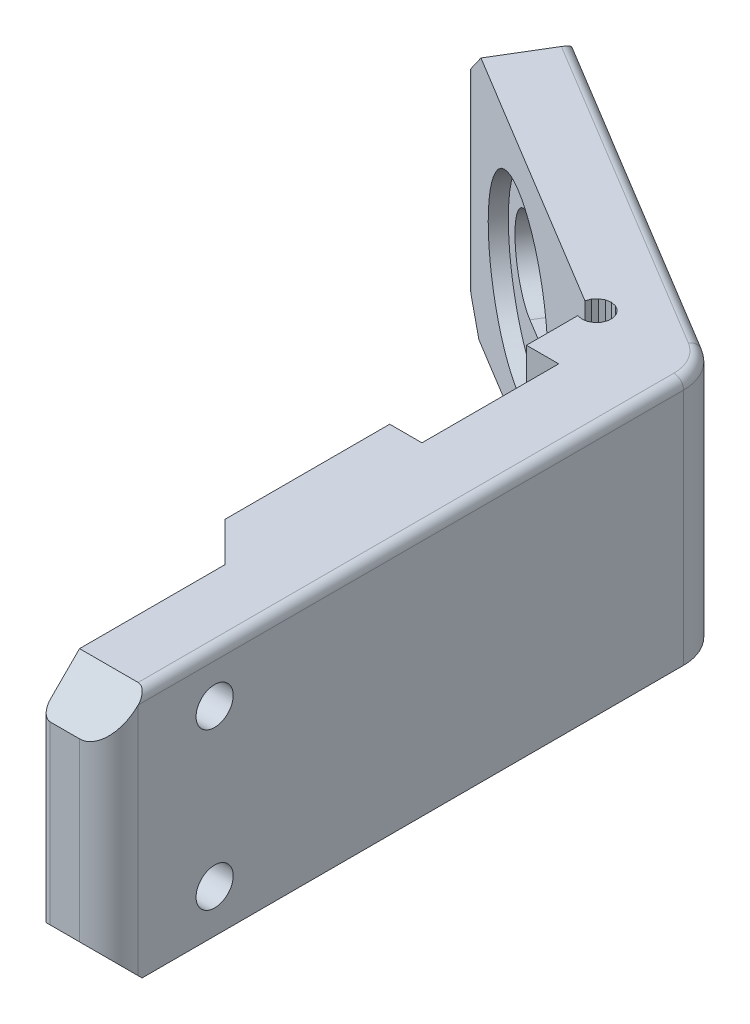
from build123d import *

# Parameters (mm, degrees)
LEG_AND_PAD_DEPTH          = 13
SCREW_HEAD_RELIEF_SKETCH_W = 14
SCREW_HEAD_RELIEF_SKETCH_H = 6
SCREW_HEAD_RELIEF_DEPTH    = 2.35
M6_SLOT_MIDDLE_DEPTH       = 4.5
SCREW_HOLES_SKETCH_R       = 1.9
SCREW_HOLES_DEPTH          = 4.5
LEG_TOP_CORNERS_SIZE       = 4
PAD_END_CORNERS_SIZE       = 4
OUTSIDE_OF_THE_BEND_R      = 5
LEG_TOP_OUTER_EDGE_R       = 3
PAD_END_OUTER_EDGE_R       = 3
LEG_TOP_INNER_EDGE_R       = 1
PAD_END_INNER_EDGE_R       = 1
BED_FACE_CHAMFER_SIZE      = 0.6
TOP_FACE_EDGE_R            = 1


with BuildPart() as part:
    # leg and pad sketch → leg and pad (new, symmetric)
    with BuildSketch(Plane(origin=(0, -20.7, 0), x_dir=(1, 0, 0), z_dir=(0, 1, 0))):
        Polygon((-0.551289683, 30.332713936), (-0.367250577, 30.819395741), (-0.028023026, 31.213926146), (0.425575667, 31.468833575), (0.938966578, 31.553446481), (1.450376329, 31.457583879), (1.898269923, 31.192780366), (2.228754897, 30.790898227), (2.402065893, 30.30029363), (2.397349395, 29.779998208), (2.215172912, 29.292616119), (1.877456693, 28.896791249), (1.424836191, 28.640150931), (0.91177263, 28.55357522), (0.4, 28.647481273), (0.4, -7.48), (4.42, -11.5), (4.42, -30.37), (11.42, -30.37), (11.42, 31.283844582), (-27.204821487, 54.594667874), (-30.821788068, 48.601542416), align=None)
    extrude(amount=LEG_AND_PAD_DEPTH, both=True)

    # screw head relief sketch → screw head relief (cut, symmetric)
    with BuildSketch(Plane(origin=(1.35, 0, 0), x_dir=(0, 0, -1), z_dir=(1, 0, 0))):
        with Locations((16.4, -9.7)):
            Rectangle(SCREW_HEAD_RELIEF_SKETCH_W, SCREW_HEAD_RELIEF_SKETCH_H)
    extrude(amount=SCREW_HEAD_RELIEF_DEPTH, both=True, mode=Mode.SUBTRACT)

    # insert flange relief sketch → insert flange relief (revolve, cut)
    with BuildSketch(Plane(origin=(0, -20.7, 0), x_dir=(1, 0, 0), z_dir=(0, 1, 0))):
        Polygon((-18.324853729, 39.891397061), (-17.03307995, 42.03179901), (-9.327632933, 37.381413406), (-10.619406712, 35.241011457), align=None)
    revolve(axis=Axis((-18.324853729, -20.7, -39.891397061), (0.5167095115681243, 0, -0.8561607796757748)), mode=Mode.SUBTRACT)

    # M6 slot end 1 sketch → M6 slot end 1 (revolve, cut)
    with BuildSketch(Plane(origin=(0, -20.7, 0), x_dir=(1, 0, 0), z_dir=(0, 1, 0))):
        Polygon((-20.465255678, 41.18317084), (-15.814870074, 48.888617857), (-11.962146565, 46.563425055), (-16.612532169, 38.857978038), align=None)
    revolve(axis=Axis((-20.465255678, -20.7, -41.18317084), (0.5167095115681236, 0, -0.8561607796757752)), mode=Mode.SUBTRACT)

    # M6 slot end 2 sketch → M6 slot end 2 (revolve, cut)
    with BuildSketch(Plane(origin=(0, -20.7, 0), x_dir=(1, 0, 0), z_dir=(0, 1, 0))):
        Polygon((-16.18445178, 38.599623282), (-11.534066176, 46.305070299), (-7.681342667, 43.979877497), (-12.331728271, 36.27443048), align=None)
    revolve(axis=Axis((-16.18445178, -20.7, -38.599623282), (0.5167095115681234, 0, -0.8561607796757752)), mode=Mode.SUBTRACT)

    # M6 slot middle sketch → M6 slot middle (cut, symmetric)
    with BuildSketch(Plane(origin=(0, -20.7, 0), x_dir=(1, 0, 0), z_dir=(0, 1, 0))):
        Polygon((-16.18445178, 38.599623282), (-20.465255678, 41.18317084), (-15.814870074, 48.888617857), (-11.534066176, 46.305070299), align=None)
    extrude(amount=M6_SLOT_MIDDLE_DEPTH, both=True, mode=Mode.SUBTRACT)

    # screw holes sketch → screw holes (cut, symmetric)
    with BuildSketch(Plane(origin=(7.92, 0, 0), x_dir=(0, 0, -1), z_dir=(1, 0, 0))):
        with Locations((-19.54, -28.7)):
            Circle(SCREW_HOLES_SKETCH_R)
        with Locations((-19.54, -12.7)):
            Circle(SCREW_HOLES_SKETCH_R)
    extrude(amount=SCREW_HOLES_DEPTH, both=True, mode=Mode.SUBTRACT)

    # leg top corners
    leg_top_corners_edges = [part.edges().sort_by_distance(p)[0] for p in [
        (7.92, -7.7, 30.37),
        (7.92, -33.7, 30.37),
    ]]
    chamfer(leg_top_corners_edges, length=LEG_TOP_CORNERS_SIZE)

    # pad end corners
    pad_end_corners_edges = [part.edges().sort_by_distance(p)[0] for p in [
        (-29.013304778, -7.7, -51.598105145),
        (-29.013304778, -33.7, -51.598105145),
    ]]
    chamfer(pad_end_corners_edges, length=PAD_END_CORNERS_SIZE)

    # outside of the bend
    outside_of_the_bend_edges = [part.edges().sort_by_distance(p)[0] for p in [
        (11.42, -20.7, -31.283844582),
    ]]
    fillet(outside_of_the_bend_edges, radius=OUTSIDE_OF_THE_BEND_R)

    # leg top outer edge
    leg_top_outer_edge_edges = [part.edges().sort_by_distance(p)[0] for p in [
        (11.42, -20.7, 30.37),
    ]]
    fillet(leg_top_outer_edge_edges, radius=LEG_TOP_OUTER_EDGE_R)

    # pad end outer edge
    pad_end_outer_edge_edges = [part.edges().sort_by_distance(p)[0] for p in [
        (-27.204821487, -20.7, -54.594667874),
    ]]
    fillet(pad_end_outer_edge_edges, radius=PAD_END_OUTER_EDGE_R)

    # leg top inner edge
    leg_top_inner_edge_edges = [part.edges().sort_by_distance(p)[0] for p in [
        (4.42, -20.7, 30.37),
    ]]
    fillet(leg_top_inner_edge_edges, radius=LEG_TOP_INNER_EDGE_R)

    # pad end inner edge
    pad_end_inner_edge_edges = [part.edges().sort_by_distance(p)[0] for p in [
        (-30.821788068, -20.7, -48.601542416),
    ]]
    fillet(pad_end_inner_edge_edges, radius=PAD_END_INNER_EDGE_R)

    # bed face chamfer
    bed_face_chamfer_edges = [part.edges().sort_by_distance(p)[0] for p in [
        (-13.974217317, -33.7, -38.433709153),
        (-7.388315405, -33.7, -42.635024987),
        (4.42, -33.7, 18.935),
        (0.4, -33.7, -10.583740636),
        (10.774178326, -33.7, -30.919287503),
        (11.42, -33.7, -1.045708124),
    ]]
    chamfer(bed_face_chamfer_edges, length=BED_FACE_CHAMFER_SIZE)

    # top face edge
    top_face_edge_edges = [part.edges().sort_by_distance(p)[0] for p in [
        (-7.388315405, -7.7, -42.635024987),
        (10.774178326, -7.7, -30.919287503),
        (11.42, -7.7, -1.045708124),
    ]]
    fillet(top_face_edge_edges, radius=TOP_FACE_EDGE_R)


solid = part.part
